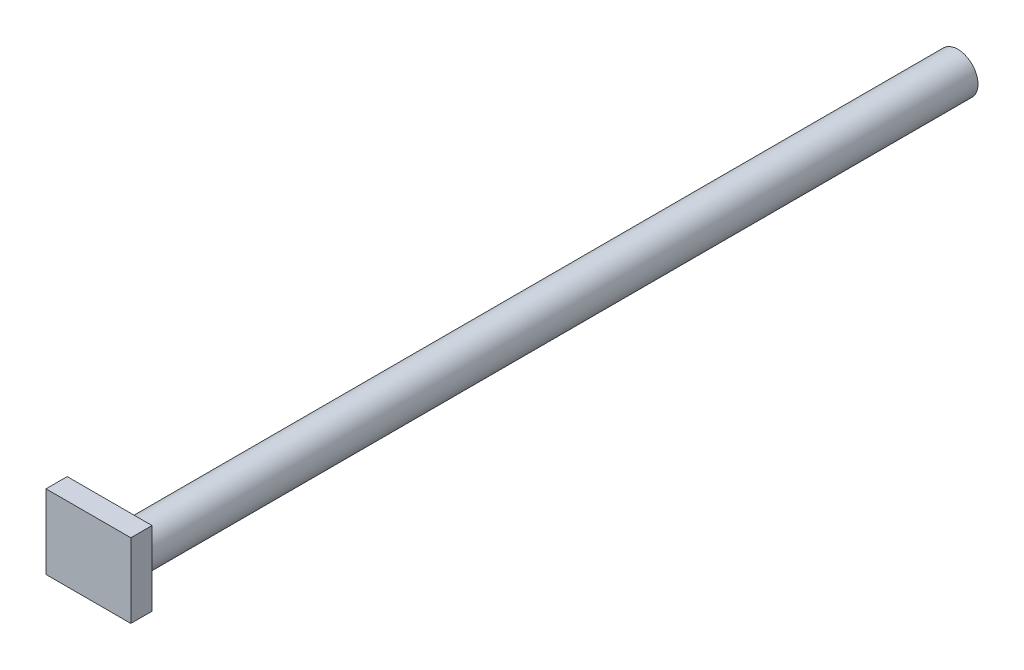
from build123d import *

# Parameters (mm, degrees)
SKETCH1_R           = 9.525
BOSS_EXTRUDE1_DEPTH = 400
SKETCH2_W           = 40
SKETCH2_H           = 35
BOSS_EXTRUDE2_DEPTH = 10


with BuildPart() as part:
    # Sketch1 → Boss-Extrude1 (new body)
    with BuildSketch(Plane.XY):
        Circle(SKETCH1_R)
    extrude(amount=BOSS_EXTRUDE1_DEPTH)

    # Sketch2 → Boss-Extrude2 (add)
    with BuildSketch(Plane.XY.offset(400)):
        with Locations((0, 7.5)):
            Rectangle(SKETCH2_W, SKETCH2_H)
    extrude(amount=BOSS_EXTRUDE2_DEPTH)


solid = part.part
